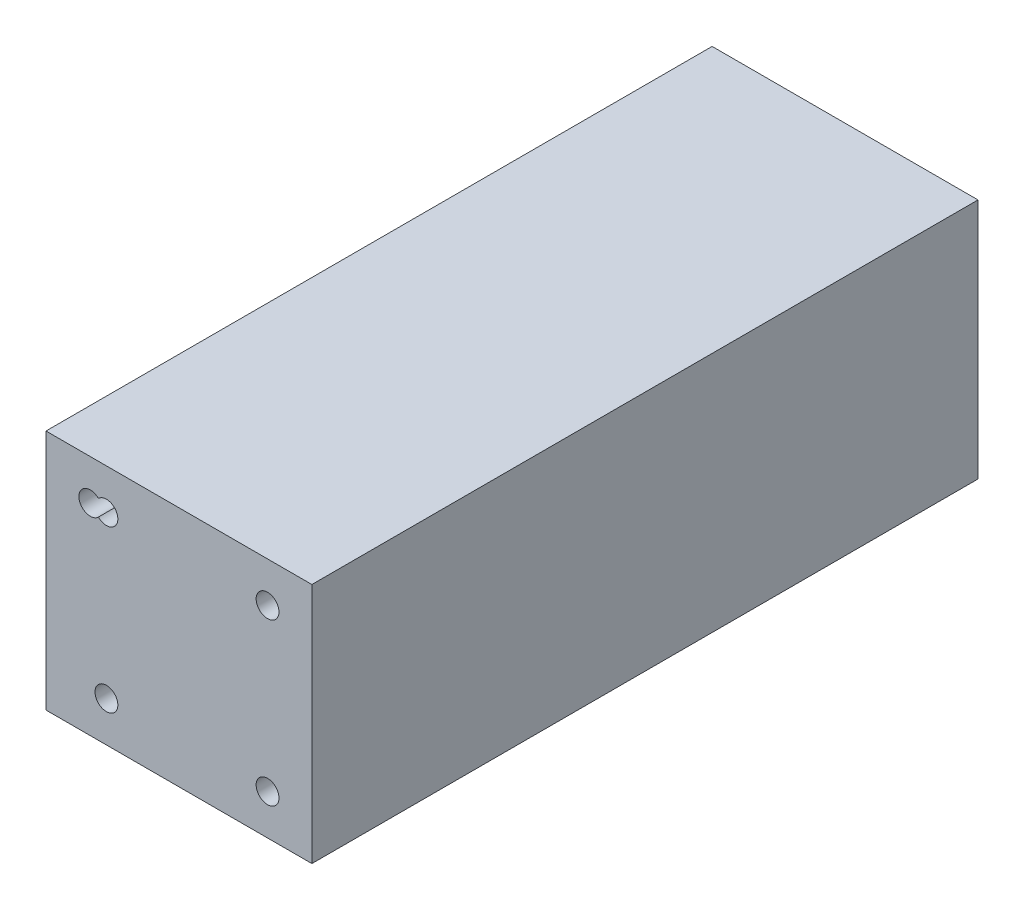
from build123d import *

# Parameters (mm, degrees)
SKETCH3_W                                           = 41.91
SKETCH3_H                                           = 38.1
BOSS_EXTRUDE1_DEPTH                                 = 5
CSK_FOR_M3_COUNTERSUNK_FLAT_HEAD_SCREW1_D           = 3.6
CSK_FOR_M3_COUNTERSUNK_FLAT_HEAD_SCREW1_DEPTH       = 10
CSK_FOR_M3_COUNTERSUNK_FLAT_HEAD_SCREW1_CSINK_D     = 6.3
CSK_FOR_M3_COUNTERSUNK_FLAT_HEAD_SCREW1_CSINK_ANGLE = 90
CSK_FOR_M3_COUNTERSUNK_FLAT_HEAD_SCREW1_TIP         = 1.081549114
CSK_FOR_M3_COUNTERSUNK_FLAT_HEAD_SCREW2_D           = 3.6
CSK_FOR_M3_COUNTERSUNK_FLAT_HEAD_SCREW2_DEPTH       = 10
CSK_FOR_M3_COUNTERSUNK_FLAT_HEAD_SCREW2_CSINK_D     = 6.3
CSK_FOR_M3_COUNTERSUNK_FLAT_HEAD_SCREW2_CSINK_ANGLE = 90
CSK_FOR_M3_COUNTERSUNK_FLAT_HEAD_SCREW2_TIP         = 1.081549114
SKETCH12_W                                          = 41.91
SKETCH12_H                                          = 38.1
BOSS_EXTRUDE2_DEPTH                                 = 100
SKETCH15_W                                          = 35.458687416
SKETCH15_H                                          = 32.541680012
CUT_EXTRUDE4_DEPTH                                  = 100


with BuildPart() as part:
    # Sketch3 → Boss-Extrude1 (new body)
    with BuildSketch(Plane.XY):
        with Locations((0, -19.05)):
            Rectangle(SKETCH3_W, SKETCH3_H)
    extrude(amount=BOSS_EXTRUDE1_DEPTH)

    # CSK for M3 Countersunk Flat Head Screw1
    with Locations(Plane(origin=(0, 0, 0), x_dir=(1, 0, 0), z_dir=(0, 0, -1))):
        with Locations((-13.97, 6.35)):
            CounterSinkHole(CSK_FOR_M3_COUNTERSUNK_FLAT_HEAD_SCREW1_D / 2, CSK_FOR_M3_COUNTERSUNK_FLAT_HEAD_SCREW1_CSINK_D / 2, depth=CSK_FOR_M3_COUNTERSUNK_FLAT_HEAD_SCREW1_DEPTH, counter_sink_angle=CSK_FOR_M3_COUNTERSUNK_FLAT_HEAD_SCREW1_CSINK_ANGLE)
            with Locations((0, 0, -(CSK_FOR_M3_COUNTERSUNK_FLAT_HEAD_SCREW1_DEPTH + CSK_FOR_M3_COUNTERSUNK_FLAT_HEAD_SCREW1_TIP / 2))):  # 118° drill point
                Cone(0, CSK_FOR_M3_COUNTERSUNK_FLAT_HEAD_SCREW1_D / 2, CSK_FOR_M3_COUNTERSUNK_FLAT_HEAD_SCREW1_TIP, mode=Mode.SUBTRACT)

    # CSK for M3 Countersunk Flat Head Screw2
    with Locations(Plane(origin=(0, 0, 0), x_dir=(1, 0, 0), z_dir=(0, 0, -1))):
        with Locations((-11.43, 31.75), (-11.43, 6.35), (13.97, 6.35), (13.97, 31.75)):
            CounterSinkHole(CSK_FOR_M3_COUNTERSUNK_FLAT_HEAD_SCREW2_D / 2, CSK_FOR_M3_COUNTERSUNK_FLAT_HEAD_SCREW2_CSINK_D / 2, depth=CSK_FOR_M3_COUNTERSUNK_FLAT_HEAD_SCREW2_DEPTH, counter_sink_angle=CSK_FOR_M3_COUNTERSUNK_FLAT_HEAD_SCREW2_CSINK_ANGLE)
            with Locations((0, 0, -(CSK_FOR_M3_COUNTERSUNK_FLAT_HEAD_SCREW2_DEPTH + CSK_FOR_M3_COUNTERSUNK_FLAT_HEAD_SCREW2_TIP / 2))):  # 118° drill point
                Cone(0, CSK_FOR_M3_COUNTERSUNK_FLAT_HEAD_SCREW2_D / 2, CSK_FOR_M3_COUNTERSUNK_FLAT_HEAD_SCREW2_TIP, mode=Mode.SUBTRACT)

    # Sketch12 → Boss-Extrude2 (add)
    with BuildSketch(Plane(origin=(0, 0, 0), x_dir=(-1, 0, 0), z_dir=(0, 0, -1))):
        with Locations((0, -19.05)):
            Rectangle(SKETCH12_W, SKETCH12_H)
    extrude(amount=BOSS_EXTRUDE2_DEPTH)

    # Sketch15 → Cut-Extrude4 (cut)
    with BuildSketch(Plane(origin=(0, 0, -100), x_dir=(-1, 0, 0), z_dir=(0, 0, -1))):
        with Locations((0, -18.974233574)):
            Rectangle(SKETCH15_W, SKETCH15_H)
    extrude(amount=-CUT_EXTRUDE4_DEPTH, mode=Mode.SUBTRACT)


solid = part.part
